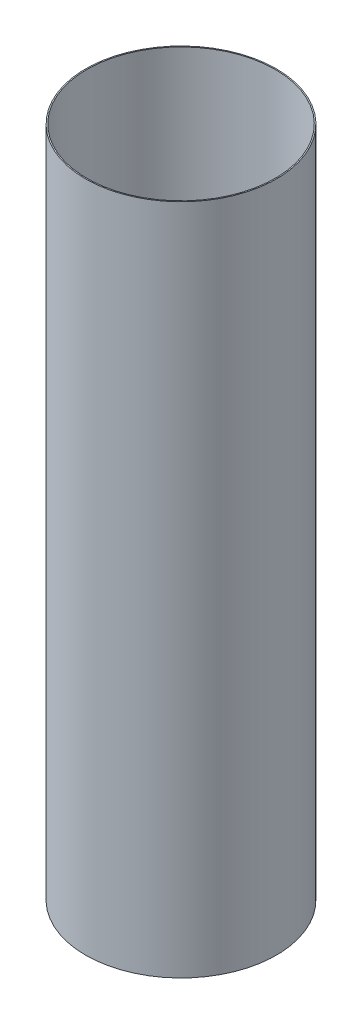
from build123d import *

# Parameters (mm, degrees)
SKETCH1_R           = 84.455
SKETCH1_R_2         = 83.439
BOSS_EXTRUDE1_DEPTH = 595.029544


with BuildPart() as part:
    # Sketch1 → Boss-Extrude1 (new body)
    with BuildSketch(Plane(origin=(0, 0, 0), x_dir=(1, 0, 0), z_dir=(0, 1, 0))):
        Circle(SKETCH1_R)
        Circle(SKETCH1_R_2, mode=Mode.SUBTRACT)
    extrude(amount=BOSS_EXTRUDE1_DEPTH)


solid = part.part
